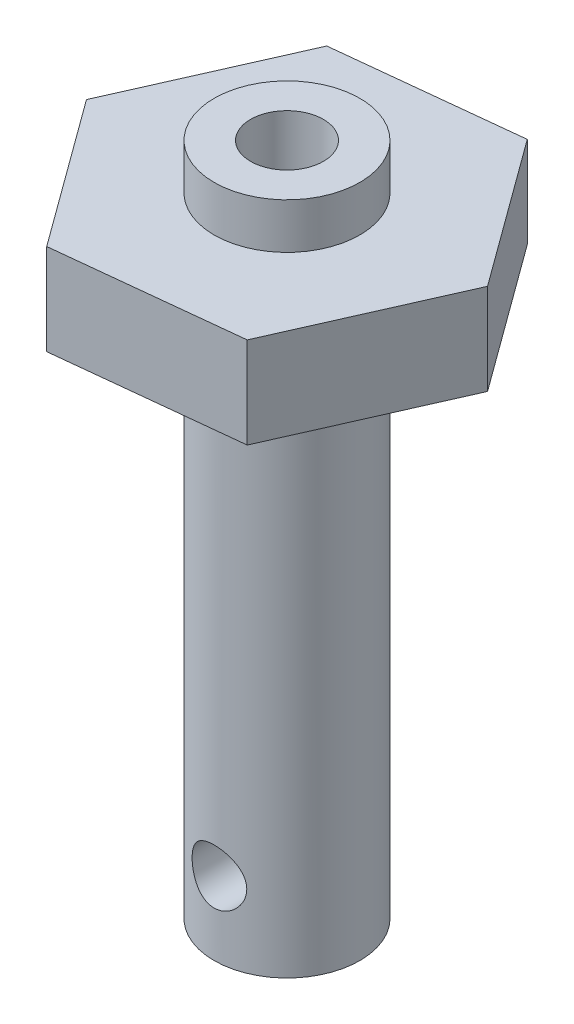
from build123d import *

# Parameters (mm, degrees)
SKETCH1_R              = 5
BOSS_EXTRUDE1_DEPTH    = 37
SKETCH2_R              = 1.5
CUT_EXTRUDE1_DEPTH     = 10
CUT_EXTRUDE2_OUTLINE_W = 1.5
CUT_EXTRUDE2_OUTLINE_H = 10.000157131
CUT_EXTRUDE3_START     = -28.5
SKETCH3_R              = 5
SKETCH3_R_2            = 4
CUT_EXTRUDE3_DEPTH     = 28.5
SKETCH4_R              = 12
BOSS_EXTRUDE2_DEPTH    = 2.5
BOSS_EXTRUDE3_DEPTH    = 5
SKETCH7_R              = 12
SKETCH7_R_2            = 4
CUT_EXTRUDE4_DEPTH     = 2.5
SKETCH8_R              = 2
CUT_EXTRUDE5_DEPTH     = 8
SKETCH9_R              = 5
SKETCH9_R_2            = 4
CUT_EXTRUDE6_DEPTH     = 32.539281195


# Read off the part's stored shape, not the designer's step: Cut-Extrude2
with BuildPart() as part:
    # Sketch1 → Boss-Extrude1 (new body)
    with BuildSketch(Plane(origin=(0, 0, 0), x_dir=(1, 0, 0), z_dir=(0, 1, 0))):
        Circle(SKETCH1_R)
    extrude(amount=BOSS_EXTRUDE1_DEPTH)

    # Sketch2 → Cut-Extrude1 (cut)
    with BuildSketch(Plane(origin=(0, 0, 0), x_dir=(-1, 0, 0), z_dir=(0, -1, 0))):
        with Locations(Location((0, 0, 0), (0, 0, 90))):
            Circle(SKETCH2_R)
    extrude(amount=-CUT_EXTRUDE1_DEPTH, mode=Mode.SUBTRACT)

    # Cut-Extrude2 outline → Cut-Extrude2 (revolve, cut)
    with BuildSketch(Plane.XZ.offset(-4)):
        with Locations((0.75, -4.8215e-05)):
            Rectangle(CUT_EXTRUDE2_OUTLINE_W, CUT_EXTRUDE2_OUTLINE_H)
    revolve(axis=Axis((0, 4, 0), (0, 0, 1)), mode=Mode.SUBTRACT)

    # Sketch3 → Cut-Extrude3 (cut)
    with BuildSketch(Plane(origin=(0, 37, 0), x_dir=(1, 0, 0), z_dir=(0, 1, 0)).offset(CUT_EXTRUDE3_START)):
        with Locations(Location((0, 0, 0), (0, 0, 270))):
            Circle(SKETCH3_R)
        with Locations(Location((0, 0, 0), (0, 0, 270))):
            Circle(SKETCH3_R_2, mode=Mode.SUBTRACT)
    extrude(amount=CUT_EXTRUDE3_DEPTH, mode=Mode.SUBTRACT)

    # Sketch4 → Boss-Extrude2 (add)
    with BuildSketch(Plane(origin=(0, 37, 0), x_dir=(1, 0, 0), z_dir=(0, 1, 0))):
        with Locations(Location((0, 0, 0), (0, 0, 270))):
            Circle(SKETCH4_R)
    extrude(amount=-BOSS_EXTRUDE2_DEPTH)

    # Sketch6 → Boss-Extrude3 (add)
    with BuildSketch(Plane.XZ.offset(-34.5)):
        Polygon((-4.048056056, 9.144027677), (-9.94298829, 1.066294458), (-5.894932233, -8.077733219), (4.048056056, -9.144027677), (9.94298829, -1.066294458), (5.894932233, 8.077733219), align=None)
    extrude(amount=BOSS_EXTRUDE3_DEPTH)

    # Sketch7 → Cut-Extrude4 (cut)
    with BuildSketch(Plane(origin=(0, 37, 0), x_dir=(1, 0, 0), z_dir=(0, 1, 0))):
        Circle(SKETCH7_R)
        with Locations(Location((0, 0, 0), (0, 0, 270))):
            Circle(SKETCH7_R_2, mode=Mode.SUBTRACT)
    extrude(amount=-CUT_EXTRUDE4_DEPTH, mode=Mode.SUBTRACT)

    # Sketch8 → Cut-Extrude5 (cut)
    with BuildSketch(Plane(origin=(0, 37, 0), x_dir=(1, 0, 0), z_dir=(0, 1, 0))):
        with Locations(Location((0, 0, 0), (0, 0, 270))):
            Circle(SKETCH8_R)
    extrude(amount=-CUT_EXTRUDE5_DEPTH, mode=Mode.SUBTRACT)

    # Sketch9 → Cut-Extrude6 (cut, through all)
    with BuildSketch(Plane(origin=(0, 8.5, 0), x_dir=(1, 0, 0), z_dir=(0, 1, 0))):
        Circle(SKETCH9_R)
        with Locations(Location((0, 0, 0), (0, 0, 270))):
            Circle(SKETCH9_R_2, mode=Mode.SUBTRACT)
    extrude(amount=-CUT_EXTRUDE6_DEPTH, mode=Mode.SUBTRACT)


solid = part.part
